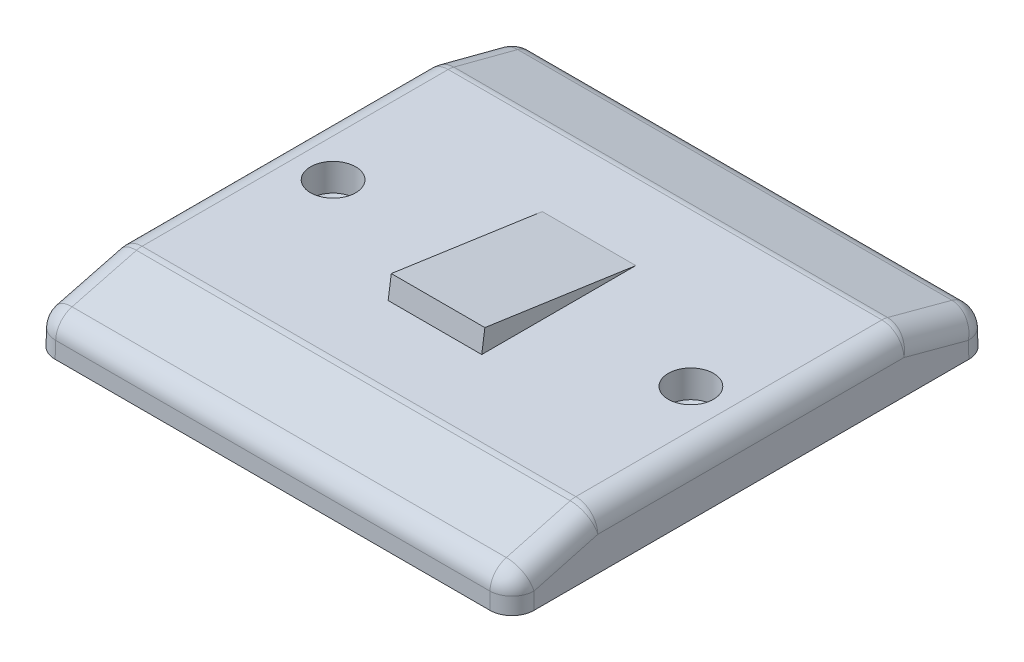
from build123d import *

# Parameters (mm, degrees)
SKETCH1_W                                      = 87
SKETCH1_H                                      = 87
BOSS_EXTRUDE1_DEPTH                            = 10
BOSS_EXTRUDE1_TAPER                            = 1
CHAMFER1_SIZE                                  = 4
CHAMFER1_SIZE_2                                = 15
BOSS_EXTRUDE2_DEPTH                            = 8.5
FILLET1_R                                      = 4
CSK_FOR_M3_5_FLAT_HEAD_MACHINE_SCREW1_AT_COUNT = 2
CSK_FOR_M3_5_FLAT_HEAD_MACHINE_SCREW1_AT_PITCH = 65


with BuildPart() as part:
    # Sketch1 → Boss-Extrude1 (new body)
    with BuildSketch(Plane(origin=(0, 0, 0), x_dir=(1, 0, 0), z_dir=(0, 1, 0))):
        Rectangle(SKETCH1_W, SKETCH1_H)
    extrude(amount=BOSS_EXTRUDE1_DEPTH, taper=BOSS_EXTRUDE1_TAPER)

    # Chamfer1
    # the kernel refuses this chamfer: 15, 4 mm, written as the material it takes off along each edge
    with BuildSketch(Plane(origin=(-82.277161627, 10, 43.325449351), x_dir=(0, -0.9879836574445086, 0.1545583793347103), z_dir=(1, 0, 0)), Plane(origin=(82.277161627, 10, -43.325449351), x_dir=(0, -0.9879836574445086, -0.1545583793347103), z_dir=(-1, 0, 0))) as chamfer1_piece_1:
        Polygon((CHAMFER1_SIZE * 0.990530598403, CHAMFER1_SIZE * 0.137292147002), (-CHAMFER1_SIZE_2 * 0.154558379335, CHAMFER1_SIZE_2 * 0.987983657445), (0, 0), align=None)
    extrude(amount=164.554323254, mode=Mode.SUBTRACT)

    # Sketch2 → Boss-Extrude2 (add, symmetric)
    with BuildSketch(Plane(origin=(0, 0, 0), x_dir=(0, 0, -1), z_dir=(1, 0, 0))):
        Polygon((-14, 10), (-13.428571429, 13.958973274), (14, 10), align=None)
    extrude(amount=BOSS_EXTRUDE2_DEPTH, both=True)

    # Fillet1
    fillet1_edges = [part.edges().sort_by_distance(p)[0] for p in [
        (43.325449351, 10, 0),
        (-43.325449351, 10, 0),
        (0, 10, 28.325449351),
        (0, 10, -28.325449351),
        (-43.447629488, 3.00030461, 43.447629488),
        (-43.447629488, 3.00030461, -43.447629488),
        (-43.360354164, 8.00030461, 35.860354164),
        (-43.360354164, 8.00030461, -35.860354164),
        (43.447629488, 3.00030461, -43.447629488),
        (0, 6.000609219, -43.395258976),
        (43.447629488, 3.00030461, 43.447629488),
        (43.360354164, 8.00030461, 35.860354164),
        (43.360354164, 8.00030461, -35.860354164),
        (0, 6.000609219, 43.395258976),
    ]]
    fillet(fillet1_edges, radius=FILLET1_R)

    # Sketch3 → CSK for M3.5 Flat Head Machine Screw1 (revolve, cut)
    with BuildSketch(Plane(origin=(-32.5, 10, 0), x_dir=(0, 0, 1), z_dir=(1, 0, 0))):
        Polygon((0, 0), (0, 10), (1.95, 10), (1.95, 7.15), (4.1, 5), (4.1, 0), align=None)
    csk_for_m3_5_flat_head_machine_screw1 = revolve(axis=Axis((-32.5, 16.35, 0), (0, -1, 0)), mode=Mode.SUBTRACT)

    # CSK for M3.5 Flat Head Machine Screw1 at: CSK for M3.5 Flat Head Machine Screw1 ×2
    with Locations(*[(i * CSK_FOR_M3_5_FLAT_HEAD_MACHINE_SCREW1_AT_PITCH, 0, 0) for i in range(1, CSK_FOR_M3_5_FLAT_HEAD_MACHINE_SCREW1_AT_COUNT)]):
        add(csk_for_m3_5_flat_head_machine_screw1, mode=Mode.SUBTRACT)


solid = part.part
